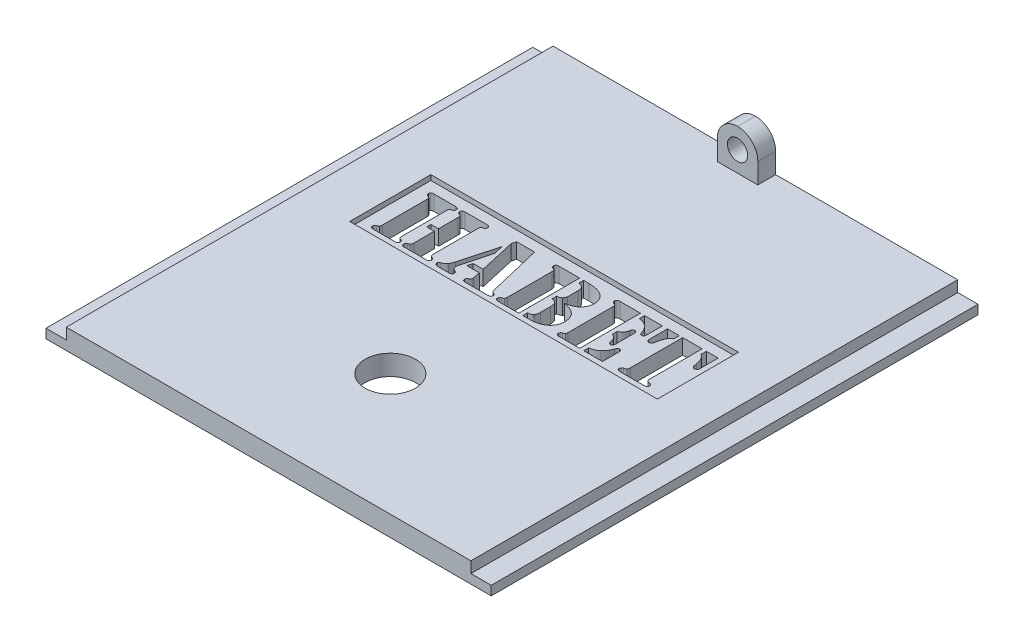
from build123d import *

# Parameters (mm, degrees)
SKETCH1_W           = 139.40028
SKETCH1_H           = 152.4
BOSS_EXTRUDE1_DEPTH = 6.35
SKETCH2_W           = 6.35
SKETCH2_H           = 152.4
CUT_EXTRUDE1_DEPTH  = 3.47472
SKETCH3_W           = 12.7
SKETCH3_H           = 5.586339271
BOSS_EXTRUDE2_DEPTH = 12.7
FILLET1_R           = 6.35
SKETCH4_R           = 3.175
CUT_EXTRUDE2_DEPTH  = 6.35
CUT_EXTRUDE7_DEPTH  = 6.35
SKETCH9_W           = 96.308333333
SKETCH9_H           = 25.4
CUT_EXTRUDE8_DEPTH  = 1.5875
SKETCH10_R          = 7.874
CUT_EXTRUDE9_DEPTH  = 207.928702993


with BuildPart() as part:
    # Sketch1 → Boss-Extrude1 (new body)
    with BuildSketch(Plane(origin=(0, 0, 0), x_dir=(1, 0, 0), z_dir=(0, 1, 0))):
        with Locations((69.70014, 76.2)):
            Rectangle(SKETCH1_W, SKETCH1_H)
    extrude(amount=BOSS_EXTRUDE1_DEPTH)

    # Sketch2 → Cut-Extrude1 (cut)
    with BuildSketch(Plane(origin=(0, 6.35, 0), x_dir=(1, 0, 0), z_dir=(0, 1, 0))):
        with Locations((3.175, 76.2)):
            Rectangle(SKETCH2_W, SKETCH2_H)
        with Locations((136.22528, 76.2)):
            Rectangle(SKETCH2_W, SKETCH2_H)
    extrude(amount=-CUT_EXTRUDE1_DEPTH, mode=Mode.SUBTRACT)

    # Sketch3 → Boss-Extrude2 (add)
    with BuildSketch(Plane(origin=(0, 6.35, 0), x_dir=(1, 0, 0), z_dir=(0, 1, 0))):
        with Locations((69.70014, 149.606830365)):
            Rectangle(SKETCH3_W, SKETCH3_H)
    extrude(amount=BOSS_EXTRUDE2_DEPTH)

    # Fillet1
    fillet1_edges = [part.edges().sort_by_distance(p)[0] for p in [
        (63.35014, 19.05, -149.606830364),
        (76.05014, 19.05, -149.606830364),
    ]]
    fillet(fillet1_edges, radius=FILLET1_R - 0.0001)  # a hair under: the kernel refuses the full size

    # Sketch4 → Cut-Extrude2 (cut)
    with BuildSketch(Plane(origin=(0, 0, -152.4), x_dir=(-1, 0, 0), z_dir=(0, 0, -1))):
        with Locations((-69.70014, 12.7)):
            Circle(SKETCH4_R)
    extrude(amount=-CUT_EXTRUDE2_DEPTH, mode=Mode.SUBTRACT)

    # Sketch7 → Cut-Extrude7 (cut)
    with BuildSketch(Plane(origin=(0, 6.35, 0), x_dir=(1, 0, 0), z_dir=(0, 1, 0))):
        with BuildLine():
            Line((33.98139, 86.51875), (36.36264, 86.51875))
            Line((36.36264, 86.51875), (36.36264, 92.674446615))
            add(Edge.make_bspline(
                [(36.36264, 92.674446615), (36.358254969, 92.79337412), (36.350353986, 93.007658614), (36.288467493, 93.292216987), (36.162305987, 93.506420615), (36.034402539, 93.575942696), (35.974033229, 93.60875651)],
                knots=[0, 0, 0, 0, 1.329658115, 2.395788229, 3.242826058, 4, 4, 4, 4], degree=3))
            Line((35.974033229, 93.60875651), (35.548219427, 93.749316406))
            add(Edge.make_bspline(
                [(35.548219427, 93.749316406), (35.470363369, 93.781123373), (35.321358774, 93.841997045), (35.155464255, 94.021364361), (35.054604435, 94.251060369), (35.044935177, 94.421992946), (35.039723333, 94.514127604)],
                knots=[0, 0, 0, 0, 1.010910902, 1.93472894, 2.886794743, 4, 4, 4, 4], degree=3))
            add(Edge.make_bspline(
                [(35.039723333, 94.514127604), (35.04336266, 94.57213883), (35.050224938, 94.681524219), (35.088866411, 94.836962832), (35.169501188, 94.963061381), (35.267416045, 95.076717923), (35.407472018, 95.152993869), (35.568945655, 95.211291763), (35.760655444, 95.243111258), (35.89676234, 95.247592183), (35.969899115, 95.25)],
                knots=[0, 0, 0, 0, 1.031021055, 1.944083, 2.799047815, 3.663736344, 4.573193868, 5.585804961, 6.702737011, 8, 8, 8, 8], degree=3))
            Line((35.969899115, 95.25), (36.346103542, 95.25))
            Line((36.346103542, 95.25), (42.448056667, 95.25))
            Line((42.448056667, 95.25), (42.824261094, 95.25))
            add(Edge.make_bspline(
                [(42.824261094, 95.25), (42.898791771, 95.247612679), (43.037665311, 95.243164367), (43.233215097, 95.21099988), (43.398335765, 95.154213485), (43.539059768, 95.075320206), (43.64142448, 94.964578719), (43.721620777, 94.836761147), (43.760533683, 94.681583868), (43.767355477, 94.572159502), (43.770973333, 94.514127604)],
                knots=[0, 0, 0, 0, 1.307240179, 2.435789904, 3.46013341, 4.359666904, 5.231495482, 6.077130894, 6.980229479, 8, 8, 8, 8], degree=3))
            add(Edge.make_bspline(
                [(43.770973333, 94.514127604), (43.765427394, 94.424815204), (43.754992327, 94.256767783), (43.654376024, 94.027773862), (43.485227457, 93.846294181), (43.333409962, 93.782563674), (43.25420901, 93.749316406)],
                knots=[0, 0, 0, 0, 1.076488905, 2.025487884, 2.96992611, 4, 4, 4, 4], degree=3))
            add(Edge.make_bspline(
                [(43.25420901, 93.749316406), (43.189425968, 93.725968045), (43.076248368, 93.685177873), (42.927147542, 93.630428772), (42.82429549, 93.589829846), (42.739491177, 93.55875196), (42.66735573, 93.495159348), (42.628064728, 93.433734975), (42.605153021, 93.397916667)],
                knots=[0, 0, 0, 0, 1.636602956, 2.859186374, 3.771360974, 4.270120389, 4.991257728, 6, 6, 6, 6], degree=3))
            add(Edge.make_bspline(
                [(42.605153021, 93.397916667), (42.579472533, 93.354754533), (42.525073829, 93.263324641), (42.485762356, 93.093362429), (42.448793771, 92.896571318), (42.44831364, 92.751884818), (42.448056667, 92.674446615)],
                knots=[0, 0, 0, 0, 0.798774196, 1.692034923, 2.764745377, 4, 4, 4, 4], degree=3))
            Line((42.448056667, 92.674446615), (42.448056667, 78.783821615))
            add(Edge.make_bspline(
                [(42.448056667, 78.783821615), (42.451553734, 78.668832217), (42.457937005, 78.458939622), (42.532250986, 78.178888253), (42.666620642, 77.962588408), (42.800976502, 77.889028473), (42.86560224, 77.853645833)],
                knots=[0, 0, 0, 0, 1.273136709, 2.323883542, 3.193780884, 4, 4, 4, 4], degree=3))
            Line((42.86560224, 77.853645833), (43.266611354, 77.700683594))
            add(Edge.make_bspline(
                [(43.266611354, 77.700683594), (43.342375807, 77.666632393), (43.488753114, 77.600845301), (43.66197076, 77.426532205), (43.752659696, 77.192828477), (43.764635802, 77.024793412), (43.770973333, 76.935872396)],
                knots=[0, 0, 0, 0, 1.008735212, 1.948881546, 2.914586453, 4, 4, 4, 4], degree=3))
            add(Edge.make_bspline(
                [(43.770973333, 76.935872396), (43.767383149, 76.877810317), (43.760613534, 76.768329042), (43.721350783, 76.613533324), (43.642901287, 76.485228447), (43.536300035, 76.379579608), (43.399994513, 76.294578242), (43.232911828, 76.239447166), (43.037758826, 76.206697784), (42.898824431, 76.202339178), (42.824261094, 76.2)],
                knots=[0, 0, 0, 0, 1.020367685, 1.923995112, 2.770125717, 3.62519578, 4.537840383, 5.562783731, 6.691994319, 8, 8, 8, 8], degree=3))
            Line((42.824261094, 76.2), (42.448056667, 76.2))
            Line((42.448056667, 76.2), (36.346103542, 76.2))
            Line((36.346103542, 76.2), (35.940960313, 76.2))
            add(Edge.make_bspline(
                [(35.940960313, 76.2), (35.870520425, 76.202386592), (35.738419135, 76.206862349), (35.552881903, 76.23946176), (35.39342755, 76.294319164), (35.265559402, 76.381088307), (35.162631216, 76.485218543), (35.091463164, 76.615493806), (35.043260004, 76.767155513), (35.040945409, 76.877573254), (35.039723333, 76.935872396)],
                knots=[0, 0, 0, 0, 1.272236934, 2.38592289, 3.394408416, 4.29229074, 5.155307538, 6.014002022, 6.951418688, 8, 8, 8, 8], degree=3))
            add(Edge.make_bspline(
                [(35.039723333, 76.935872396), (35.045537841, 77.025063688), (35.056560809, 77.194149861), (35.154074399, 77.423933889), (35.322342623, 77.603448603), (35.470519219, 77.667235365), (35.548219427, 77.700683594)],
                knots=[0, 0, 0, 0, 1.082756457, 2.052657179, 2.978860728, 4, 4, 4, 4], degree=3))
            Line((35.548219427, 77.700683594), (35.974033229, 77.853645833))
            add(Edge.make_bspline(
                [(35.974033229, 77.853645833), (36.034583478, 77.883362518), (36.164380885, 77.947064133), (36.287999465, 78.162629813), (36.350817717, 78.447572739), (36.358406621, 78.663416038), (36.36264, 78.783821615)],
                knots=[0, 0, 0, 0, 0.740865868, 1.588143233, 2.65457484, 4, 4, 4, 4], degree=3))
            Line((36.36264, 78.783821615), (36.36264, 85.195833333))
            Line((36.36264, 85.195833333), (33.98139, 85.195833333))
            Line((33.98139, 85.195833333), (33.98139, 86.51875))
        make_face()
        with BuildLine():
            Line((32.670875677, 76.2), (26.560654323, 76.2))
            Line((26.560654323, 76.2), (26.19685224, 76.2))
            add(Edge.make_bspline(
                [(26.19685224, 76.2), (26.125040689, 76.202376158), (25.99021491, 76.20683738), (25.799288606, 76.239878552), (25.632545952, 76.295443288), (25.493913669, 76.379738123), (25.3803164, 76.484168123), (25.308200717, 76.615713486), (25.258386897, 76.762863504), (25.25299464, 76.867876553), (25.25014, 76.923470052)],
                knots=[0, 0, 0, 0, 1.275809178, 2.395324508, 3.433364274, 4.378530456, 5.262016052, 6.140052186, 7.015350866, 8, 8, 8, 8], degree=3))
            add(Edge.make_bspline(
                [(25.25014, 76.923470052), (25.255764401, 77.011322637), (25.266343696, 77.176570169), (25.365586585, 77.402040721), (25.53902331, 77.574260052), (25.688152596, 77.638055756), (25.766904323, 77.671744792)],
                knots=[0, 0, 0, 0, 1.074896783, 2.021841926, 2.955380476, 4, 4, 4, 4], degree=3))
            add(Edge.make_bspline(
                [(25.766904323, 77.671744792), (25.831764671, 77.694901049), (25.945077324, 77.73535561), (26.091766098, 77.791349819), (26.194674971, 77.827086055), (26.278053349, 77.859200862), (26.353929924, 77.919864491), (26.393323411, 77.982828852), (26.415960313, 78.019010417)],
                knots=[0, 0, 0, 0, 1.641128884, 2.867093284, 3.73955991, 4.239698614, 4.988468111, 6, 6, 6, 6], degree=3))
            add(Edge.make_bspline(
                [(26.415960313, 78.019010417), (26.441295424, 78.060864408), (26.495870371, 78.151023056), (26.540989365, 78.315666281), (26.570686683, 78.509819854), (26.572223759, 78.649989265), (26.573056667, 78.72594401)],
                knots=[0, 0, 0, 0, 0.795728394, 1.714096871, 2.761318972, 4, 4, 4, 4], degree=3))
            Line((26.573056667, 78.72594401), (26.573056667, 92.674446615))
            add(Edge.make_bspline(
                [(26.573056667, 92.674446615), (26.572046863, 92.751741764), (26.570162914, 92.895948045), (26.542191832, 93.09462471), (26.494872664, 93.262615041), (26.441203426, 93.354635303), (26.415960313, 93.397916667)],
                knots=[0, 0, 0, 0, 1.234380862, 2.302932019, 3.201790819, 4, 4, 4, 4], degree=3))
            add(Edge.make_bspline(
                [(26.415960313, 93.397916667), (26.393311355, 93.434066441), (26.353896887, 93.496975479), (26.278134024, 93.55793895), (26.193961827, 93.589345755), (26.092981985, 93.631533479), (25.944777423, 93.684916037), (25.831655498, 93.725872729), (25.766904323, 93.749316406)],
                knots=[0, 0, 0, 0, 1.009569614, 1.75688657, 2.256055053, 3.138468602, 4.362054748, 6, 6, 6, 6], degree=3))
            add(Edge.make_bspline(
                [(25.766904323, 93.749316406), (25.687703372, 93.782563674), (25.535885877, 93.846294181), (25.366737309, 94.027773862), (25.266121006, 94.256767783), (25.255685939, 94.424815204), (25.25014, 94.514127604)],
                knots=[0, 0, 0, 0, 1.03007389, 1.974512116, 2.923511095, 4, 4, 4, 4], degree=3))
            add(Edge.make_bspline(
                [(25.25014, 94.514127604), (25.253061441, 94.571058029), (25.258584712, 94.678690563), (25.307217029, 94.829116359), (25.380433718, 94.961594207), (25.493782166, 95.066425937), (25.633401371, 95.149446212), (25.798303404, 95.211468089), (25.990370768, 95.242735765), (26.125094854, 95.2474755), (26.19685224, 95.25)],
                knots=[0, 0, 0, 0, 1.002003185, 1.894384998, 2.766311233, 3.643649008, 4.582238159, 5.621343591, 6.733068665, 8, 8, 8, 8], degree=3))
            Line((26.19685224, 95.25), (26.560654323, 95.25))
            Line((26.560654323, 95.25), (32.670875677, 95.25))
            Line((32.670875677, 95.25), (33.03467776, 95.25))
            add(Edge.make_bspline(
                [(33.03467776, 95.25), (33.109208438, 95.247612679), (33.248081978, 95.243164367), (33.443631763, 95.21099988), (33.608752432, 95.154213485), (33.749476435, 95.075320206), (33.851841147, 94.964578719), (33.932037444, 94.836761147), (33.970950349, 94.681583868), (33.977772143, 94.572159502), (33.98139, 94.514127604)],
                knots=[0, 0, 0, 0, 1.307240179, 2.435789904, 3.46013341, 4.359666904, 5.231495482, 6.077130894, 6.980229479, 8, 8, 8, 8], degree=3))
            add(Edge.make_bspline(
                [(33.98139, 94.514127604), (33.976105432, 94.42206441), (33.966301251, 94.251264417), (33.865944671, 94.019796617), (33.695643123, 93.843228467), (33.546317909, 93.781419437), (33.468759792, 93.749316406)],
                knots=[0, 0, 0, 0, 1.109983163, 2.059293279, 2.992015108, 4, 4, 4, 4], degree=3))
            Line((33.468759792, 93.749316406), (33.051214219, 93.60875651))
            add(Edge.make_bspline(
                [(33.051214219, 93.60875651), (32.98888829, 93.5764385), (32.858683699, 93.508923206), (32.738857753, 93.289917427), (32.668583654, 93.008801655), (32.662078061, 92.793657362), (32.658473333, 92.674446615)],
                knots=[0, 0, 0, 0, 0.768469074, 1.605402508, 2.673161374, 4, 4, 4, 4], degree=3))
            Line((32.658473333, 92.674446615), (32.658473333, 78.72594401))
            add(Edge.make_bspline(
                [(32.658473333, 78.72594401), (32.661883817, 78.609413714), (32.668025728, 78.399555311), (32.740580589, 78.124696759), (32.858603203, 77.907979191), (32.988862232, 77.840480592), (33.051214219, 77.808170573)],
                knots=[0, 0, 0, 0, 1.316005662, 2.369983217, 3.219748642, 4, 4, 4, 4], degree=3))
            Line((33.051214219, 77.808170573), (33.468759792, 77.671744792))
            add(Edge.make_bspline(
                [(33.468759792, 77.671744792), (33.546199843, 77.641049819), (33.694905023, 77.582107431), (33.867066383, 77.409191576), (33.964979806, 77.180475024), (33.975695118, 77.012659308), (33.98139, 76.923470052)],
                knots=[0, 0, 0, 0, 1.013906066, 1.946965185, 2.908870689, 4, 4, 4, 4], degree=3))
            add(Edge.make_bspline(
                [(33.98139, 76.923470052), (33.977716568, 76.866780426), (33.970711377, 76.758673959), (33.931592537, 76.60541922), (33.854459795, 76.477255135), (33.746284361, 76.375168893), (33.609219932, 76.29532482), (33.443486072, 76.239144002), (33.248126903, 76.206791266), (33.109224128, 76.202371826), (33.03467776, 76.2)],
                knots=[0, 0, 0, 0, 1.003012501, 1.91273332, 2.764569601, 3.608364563, 4.51449415, 5.546348955, 6.6831741, 8, 8, 8, 8], degree=3))
            Line((33.03467776, 76.2), (32.670875677, 76.2))
        make_face()
        with BuildLine():
            Line((52.097080104, 95.25), (57.719475938, 95.25))
            Line((57.719475938, 95.25), (61.626214219, 78.849967448))
            add(Edge.make_bspline(
                [(61.626214219, 78.849967448), (61.663908229, 78.714167542), (61.735791565, 78.45519403), (61.832431222, 78.204426775), (61.878395208, 78.08515625)],
                knots=[0, 0, 0, 0, 1.048755183, 2, 2, 2, 2], degree=3))
            add(Edge.make_bspline(
                [(61.878395208, 78.08515625), (61.903775603, 78.040721307), (61.956415575, 77.948561425), (62.086098711, 77.836151776), (62.247337704, 77.73267795), (62.373455726, 77.679435031), (62.440634792, 77.651074219)],
                knots=[0, 0, 0, 0, 0.840160251, 1.742526606, 2.797515595, 4, 4, 4, 4], degree=3))
            add(Edge.make_bspline(
                [(62.440634792, 77.651074219), (62.546019514, 77.60421987), (62.72678057, 77.523852987), (62.947620792, 77.365376206), (63.073527844, 77.159540795), (63.081391452, 77.007916743), (63.085556667, 76.927604167)],
                knots=[0, 0, 0, 0, 1.326867952, 2.275909135, 3.086779591, 4, 4, 4, 4], degree=3))
            add(Edge.make_bspline(
                [(63.085556667, 76.927604167), (63.083044393, 76.870610428), (63.078197883, 76.760661926), (63.022192103, 76.608108908), (62.931589388, 76.477852908), (62.803885359, 76.373596881), (62.640694722, 76.295202274), (62.445308952, 76.238324756), (62.214241495, 76.207023002), (62.049365909, 76.202449202), (61.9610775, 76.2)],
                knots=[0, 0, 0, 0, 0.899652897, 1.735550104, 2.535289427, 3.388132219, 4.315971308, 5.386976564, 6.600765056, 8, 8, 8, 8], degree=3))
            Line((61.9610775, 76.2), (54.999228542, 76.2))
            add(Edge.make_bspline(
                [(54.999228542, 76.2), (54.934178971, 76.201768506), (54.808151906, 76.205194811), (54.63154095, 76.248414359), (54.471893417, 76.310201857), (54.336293061, 76.400351231), (54.227086661, 76.513792589), (54.145592604, 76.644076493), (54.099425362, 76.793726157), (54.093028058, 76.898358033), (54.089723333, 76.952408854)],
                knots=[0, 0, 0, 0, 1.175318829, 2.277063206, 3.273429624, 4.263211015, 5.198644873, 6.106027898, 7.021610334, 8, 8, 8, 8], degree=3))
            add(Edge.make_bspline(
                [(54.089723333, 76.952408854), (54.092333304, 77.03589774), (54.096978067, 77.184476414), (54.169258916, 77.358870658), (54.267663195, 77.465599972), (54.375519239, 77.546627241), (54.509765512, 77.642792935), (54.615420346, 77.701802334), (54.67263349, 77.73375651)],
                knots=[0, 0, 0, 0, 1.432553572, 2.549404146, 3.155101411, 3.915709373, 4.871335893, 6, 6, 6, 6], degree=3))
            add(Edge.make_bspline(
                [(54.67263349, 77.73375651), (54.749784625, 77.781089926), (54.888697166, 77.866314921), (55.048779309, 78.038471568), (55.139320671, 78.245156556), (55.145018229, 78.394252163), (55.148056667, 78.473763021)],
                knots=[0, 0, 0, 0, 1.161992046, 2.092195629, 2.982591342, 4, 4, 4, 4], degree=3))
            add(Edge.make_bspline(
                [(55.148056667, 78.473763021), (55.147476783, 78.549752782), (55.146385804, 78.692718112), (55.122186422, 78.833584537), (55.110849635, 78.899576823)],
                knots=[0, 0, 0, 0, 1.063051602, 2, 2, 2, 2], degree=3))
            Line((55.110849635, 78.899576823), (54.705706406, 80.9625))
            Line((54.705706406, 80.9625), (50.815504583, 80.9625))
            Line((50.815504583, 80.9625), (51.19170901, 82.55))
            Line((51.19170901, 82.55), (54.317099635, 82.55))
            Line((54.317099635, 82.55), (51.749814479, 93.8609375))
            Line((51.749814479, 93.8609375), (52.097080104, 95.25))
        make_face()
        with BuildLine():
            Line((51.133831406, 91.653320312), (51.844899115, 88.751171875))
            Line((51.844899115, 88.751171875), (49.434710313, 79.780143229))
            add(Edge.make_bspline(
                [(49.434710313, 79.780143229), (49.404442749, 79.656718777), (49.346438878, 79.420191774), (49.333439419, 79.177065489), (49.327223333, 79.060807292)],
                knots=[0, 0, 0, 0, 1.043639418, 2, 2, 2, 2], degree=3))
            add(Edge.make_bspline(
                [(49.327223333, 79.060807292), (49.334278502, 78.924141807), (49.347750577, 78.663174622), (49.497289144, 78.306918913), (49.732700161, 78.007051937), (49.950233498, 77.87882982), (50.063095729, 77.812304687)],
                knots=[0, 0, 0, 0, 1.065909191, 2.035388236, 2.980705811, 4, 4, 4, 4], degree=3))
            Line((50.063095729, 77.812304687), (50.501311875, 77.5890625))
            add(Edge.make_bspline(
                [(50.501311875, 77.5890625), (50.564634562, 77.551119218), (50.685353588, 77.478783754), (50.822393704, 77.314781266), (50.902845564, 77.114995286), (50.910673713, 76.969696514), (50.914723333, 76.89453125)],
                knots=[0, 0, 0, 0, 1.03129857, 1.96607825, 2.947821365, 4, 4, 4, 4], degree=3))
            add(Edge.make_bspline(
                [(50.914723333, 76.89453125), (50.913414574, 76.840364794), (50.910910151, 76.736712589), (50.862304065, 76.593243141), (50.791211119, 76.470365505), (50.693387766, 76.3651821), (50.560513591, 76.293418377), (50.404283934, 76.239008435), (50.22006117, 76.20690764), (50.088025413, 76.202402343), (50.017620469, 76.2)],
                knots=[0, 0, 0, 0, 1.001089615, 1.915671698, 2.776004461, 3.626767041, 4.544209435, 5.547912865, 6.692482548, 8, 8, 8, 8], degree=3))
            Line((50.017620469, 76.2), (46.474684271, 76.2))
            add(Edge.make_bspline(
                [(46.474684271, 76.2), (46.393165819, 76.201748698), (46.237223015, 76.205093915), (46.017440351, 76.247354884), (45.82223882, 76.312594435), (45.657289001, 76.406213205), (45.52349119, 76.525301254), (45.42643889, 76.666646734), (45.371082155, 76.831477198), (45.362779988, 76.9464905), (45.358473333, 77.006152344)],
                knots=[0, 0, 0, 0, 1.263225168, 2.41651886, 3.457937625, 4.444571192, 5.337806274, 6.215550556, 7.074337118, 8, 8, 8, 8], degree=3))
            add(Edge.make_bspline(
                [(45.358473333, 77.006152344), (45.365632938, 77.072691554), (45.380469635, 77.210579343), (45.51241368, 77.394878213), (45.711854483, 77.554665749), (45.878451373, 77.632794376), (45.970322292, 77.675878906)],
                knots=[0, 0, 0, 0, 0.824400861, 1.708388363, 2.736276122, 4, 4, 4, 4], degree=3))
            add(Edge.make_bspline(
                [(45.970322292, 77.675878906), (46.060215941, 77.715116947), (46.229184636, 77.788870772), (46.460757524, 77.902778389), (46.651523513, 78.015274139), (46.864259539, 78.156330633), (47.100586801, 78.369083883), (47.25646636, 78.570211968), (47.338714219, 78.676334635)],
                knots=[0, 0, 0, 0, 1.026075952, 1.928664772, 2.697596979, 3.341335493, 4.597189607, 6, 6, 6, 6], degree=3))
            add(Edge.make_bspline(
                [(47.338714219, 78.676334635), (47.402883936, 78.778493946), (47.536952591, 78.991933588), (47.702873981, 79.351142535), (47.858697725, 79.753364872), (47.938043795, 80.042488231), (47.979501979, 80.193554687)],
                knots=[0, 0, 0, 0, 0.874304226, 1.826668352, 2.864437965, 4, 4, 4, 4], degree=3))
            Line((47.979501979, 80.193554687), (51.133831406, 91.653320312))
        make_face()
        with BuildLine():
            Line((71.816806667, 95.25), (71.816806667, 76.2))
            Line((71.816806667, 76.2), (65.718987656, 76.2))
            Line((65.718987656, 76.2), (65.355185573, 76.2))
            add(Edge.make_bspline(
                [(65.355185573, 76.2), (65.283374023, 76.202376158), (65.148548243, 76.20683738), (64.95762194, 76.239878552), (64.790879285, 76.295443288), (64.652247002, 76.379738123), (64.538649733, 76.484168123), (64.466534051, 76.615713486), (64.41672023, 76.762863504), (64.411327973, 76.867876553), (64.408473333, 76.923470052)],
                knots=[0, 0, 0, 0, 1.275809178, 2.395324508, 3.433364274, 4.378530456, 5.262016052, 6.140052186, 7.015350866, 8, 8, 8, 8], degree=3))
            add(Edge.make_bspline(
                [(64.408473333, 76.923470052), (64.414097735, 77.011322637), (64.42467703, 77.176570169), (64.523919918, 77.402040721), (64.697356644, 77.574260052), (64.84648593, 77.638055756), (64.925237656, 77.671744792)],
                knots=[0, 0, 0, 0, 1.074896783, 2.021841926, 2.955380476, 4, 4, 4, 4], degree=3))
            add(Edge.make_bspline(
                [(64.925237656, 77.671744792), (64.990098004, 77.694901049), (65.103410658, 77.73535561), (65.250099431, 77.791349819), (65.353008305, 77.827086055), (65.436386683, 77.859200862), (65.512263257, 77.919864491), (65.551656744, 77.982828852), (65.574293646, 78.019010417)],
                knots=[0, 0, 0, 0, 1.641128884, 2.867093284, 3.73955991, 4.239698614, 4.988468111, 6, 6, 6, 6], degree=3))
            add(Edge.make_bspline(
                [(65.574293646, 78.019010417), (65.599628757, 78.060864408), (65.654203704, 78.151023056), (65.699322698, 78.315666281), (65.729020017, 78.509819854), (65.730557092, 78.649989265), (65.73139, 78.72594401)],
                knots=[0, 0, 0, 0, 0.795728394, 1.714096871, 2.761318972, 4, 4, 4, 4], degree=3))
            Line((65.73139, 78.72594401), (65.73139, 92.674446615))
            add(Edge.make_bspline(
                [(65.73139, 92.674446615), (65.730380196, 92.751741764), (65.728496247, 92.895948045), (65.700525166, 93.09462471), (65.653205998, 93.262615041), (65.599536759, 93.354635303), (65.574293646, 93.397916667)],
                knots=[0, 0, 0, 0, 1.234380862, 2.302932019, 3.201790819, 4, 4, 4, 4], degree=3))
            add(Edge.make_bspline(
                [(65.574293646, 93.397916667), (65.551644688, 93.434066441), (65.512230221, 93.496975479), (65.436467358, 93.55793895), (65.35229516, 93.589345755), (65.251315318, 93.631533479), (65.103110757, 93.684916037), (64.989988831, 93.725872729), (64.925237656, 93.749316406)],
                knots=[0, 0, 0, 0, 1.009569614, 1.75688657, 2.256055053, 3.138468602, 4.362054748, 6, 6, 6, 6], degree=3))
            add(Edge.make_bspline(
                [(64.925237656, 93.749316406), (64.846036705, 93.782563674), (64.69421921, 93.846294181), (64.525070643, 94.027773862), (64.424454339, 94.256767783), (64.414019273, 94.424815204), (64.408473333, 94.514127604)],
                knots=[0, 0, 0, 0, 1.03007389, 1.974512116, 2.923511095, 4, 4, 4, 4], degree=3))
            add(Edge.make_bspline(
                [(64.408473333, 94.514127604), (64.411394775, 94.571058029), (64.416918045, 94.678690563), (64.465550362, 94.829116359), (64.538767051, 94.961594207), (64.652115499, 95.066425937), (64.791734704, 95.149446212), (64.956636737, 95.211468089), (65.148704101, 95.242735765), (65.283428187, 95.2474755), (65.355185573, 95.25)],
                knots=[0, 0, 0, 0, 1.002003185, 1.894384998, 2.766311233, 3.643649008, 4.582238159, 5.621343591, 6.733068665, 8, 8, 8, 8], degree=3))
            Line((65.355185573, 95.25), (65.718987656, 95.25))
            Line((65.718987656, 95.25), (71.816806667, 95.25))
        make_face()
        with BuildLine():
            add(Edge.make_bspline(
                [(76.281650417, 86.014388021), (76.478840916, 85.973691726), (76.849208839, 85.897254968), (77.368896462, 85.779986424), (77.813759769, 85.655927045), (78.304961766, 85.498926129), (78.849044115, 85.284018209), (79.234934634, 85.047078267), (79.4235775, 84.93125)],
                knots=[0, 0, 0, 0, 1.083455462, 2.034972021, 2.866135129, 3.567292239, 4.810769005, 6, 6, 6, 6], degree=3))
            add(Edge.make_bspline(
                [(79.4235775, 84.93125), (79.572639243, 84.827566522), (79.867499636, 84.622469287), (80.255212908, 84.249710742), (80.585392286, 83.827269243), (80.855667388, 83.357932162), (81.078101722, 82.854721736), (81.226915086, 82.316775349), (81.328808281, 81.753222551), (81.337410142, 81.366741365), (81.341806667, 81.169205729)],
                knots=[0, 0, 0, 0, 0.986962337, 1.952319205, 2.913940247, 3.895330921, 4.892864158, 5.89929397, 6.926301415, 8, 8, 8, 8], degree=3))
            add(Edge.make_bspline(
                [(81.341806667, 81.169205729), (81.335874739, 80.976013916), (81.324341144, 80.600386192), (81.245419652, 80.052355628), (81.110317481, 79.536610943), (80.91286287, 79.055553817), (80.669584652, 78.602629484), (80.362028387, 78.188372275), (80.008538741, 77.799140165), (79.732698478, 77.577318637), (79.593076198, 77.465039062)],
                knots=[0, 0, 0, 0, 1.089371359, 2.118092263, 3.115302193, 4.087984299, 5.044386056, 6.006580044, 6.990989071, 8, 8, 8, 8], degree=3))
            add(Edge.make_bspline(
                [(79.593076198, 77.465039062), (79.441047279, 77.354003712), (79.138956806, 77.133369887), (78.645663877, 76.865959611), (78.132108768, 76.646282421), (77.585889358, 76.471531415), (76.985383601, 76.350047773), (76.31295452, 76.259821661), (75.556250222, 76.207495878), (75.023584027, 76.202581604), (74.743759792, 76.2)],
                knots=[0, 0, 0, 0, 0.883012022, 1.754597232, 2.627046443, 3.502775865, 4.441750639, 5.499460937, 6.686397901, 8, 8, 8, 8], degree=3))
            Line((74.743759792, 76.2), (73.081845729, 76.2))
            Line((73.081845729, 76.2), (73.081845729, 77.667610677))
            add(Edge.make_bspline(
                [(73.081845729, 77.667610677), (73.170215368, 77.674481121), (73.337916393, 77.687519315), (73.571699745, 77.727195563), (73.777443806, 77.765382097), (74.011722197, 77.837195971), (74.279274479, 77.974402899), (74.447234826, 78.140818883), (74.532919948, 78.225716146)],
                knots=[0, 0, 0, 0, 0.997306068, 1.892609856, 2.668508782, 3.350634199, 4.648423657, 6, 6, 6, 6], degree=3))
            add(Edge.make_bspline(
                [(74.532919948, 78.225716146), (74.605854051, 78.320517532), (74.759336565, 78.520017552), (74.889075163, 78.901386305), (74.979411386, 79.341630385), (74.987486486, 79.659625259), (74.991806667, 79.829752604)],
                knots=[0, 0, 0, 0, 0.837912566, 1.76330307, 2.803366532, 4, 4, 4, 4], degree=3))
            Line((74.991806667, 79.829752604), (74.991806667, 82.963411458))
            add(Edge.make_bspline(
                [(74.991806667, 82.963411458), (74.989920245, 83.072301518), (74.986334776, 83.279265741), (74.968068927, 83.56944867), (74.931294449, 83.822832007), (74.861155711, 84.107472648), (74.722093396, 84.438105106), (74.534248838, 84.646514429), (74.437835313, 84.753483073)],
                knots=[0, 0, 0, 0, 1.01571249, 1.930535679, 2.71034331, 3.399269007, 4.665142888, 6, 6, 6, 6], degree=3))
            add(Edge.make_bspline(
                [(74.437835313, 84.753483073), (74.359907295, 84.829609551), (74.208827981, 84.977196214), (73.915700236, 85.127830957), (73.55914543, 85.234768064), (73.292193952, 85.273137306), (73.139723333, 85.295052083)],
                knots=[0, 0, 0, 0, 0.904188909, 1.752954129, 2.716588957, 4, 4, 4, 4], degree=3))
            Line((73.139723333, 85.295052083), (73.139723333, 86.737858073))
            add(Edge.make_bspline(
                [(73.139723333, 86.737858073), (73.291706292, 86.752308872), (73.559500905, 86.77777124), (73.922828212, 86.857187916), (74.21628901, 86.997650878), (74.374213644, 87.129713499), (74.454371771, 87.196744792)],
                knots=[0, 0, 0, 0, 1.287514427, 2.268605844, 3.12119275, 4, 4, 4, 4], degree=3))
            add(Edge.make_bspline(
                [(74.454371771, 87.196744792), (74.52526596, 87.274237889), (74.673522786, 87.436294618), (74.832087179, 87.731936014), (74.956331797, 88.036774983), (74.980631355, 88.248607402), (74.991806667, 88.346028646)],
                knots=[0, 0, 0, 0, 0.970759611, 2.030092153, 3.0940439, 4, 4, 4, 4], degree=3))
            Line((74.991806667, 88.346028646), (74.991806667, 89.110839844))
            Line((74.991806667, 89.110839844), (74.991806667, 91.595442708))
            add(Edge.make_bspline(
                [(74.991806667, 91.595442708), (74.985026886, 91.724273986), (74.971006393, 91.99069529), (74.868524816, 92.37648405), (74.7519606, 92.740008769), (74.61828646, 92.942413827), (74.557724635, 93.034114583)],
                knots=[0, 0, 0, 0, 1.013786551, 2.096496594, 3.137607017, 4, 4, 4, 4], degree=3))
            add(Edge.make_bspline(
                [(74.557724635, 93.034114583), (74.468083274, 93.130992506), (74.295328802, 93.31769309), (74.022476146, 93.487889106), (73.782512852, 93.581789381), (73.573974052, 93.637155092), (73.338696589, 93.689316001), (73.170319818, 93.706968127), (73.081845729, 93.71624349)],
                knots=[0, 0, 0, 0, 1.414668104, 2.726311148, 3.411527514, 4.180983567, 5.044192262, 6, 6, 6, 6], degree=3))
            Line((73.081845729, 93.71624349), (73.081845729, 95.25))
            Line((73.081845729, 95.25), (74.685882188, 95.25))
            add(Edge.make_bspline(
                [(74.685882188, 95.25), (74.942332652, 95.246314056), (75.439491228, 95.239168432), (76.161710672, 95.176113185), (76.83613003, 95.074792576), (77.464078067, 94.930789095), (78.044483574, 94.744140427), (78.582028472, 94.522092075), (79.073710797, 94.255746964), (79.366629533, 94.038058728), (79.510393906, 93.931217448)],
                knots=[0, 0, 0, 0, 1.208139577, 2.342116839, 3.412856412, 4.419296771, 5.374125253, 6.282151548, 7.156880815, 8, 8, 8, 8], degree=3))
            add(Edge.make_bspline(
                [(79.510393906, 93.931217448), (79.63310187, 93.828067387), (79.874746233, 93.624937695), (80.186427223, 93.270424721), (80.45802493, 92.889424605), (80.680115548, 92.474429803), (80.857130541, 92.037771895), (80.98864178, 91.58113807), (81.062715908, 91.105934653), (81.0723635, 90.782644397), (81.077223333, 90.619791667)],
                knots=[0, 0, 0, 0, 1.013187354, 1.995233284, 2.977588935, 3.968692565, 4.966259194, 5.954519567, 6.969619199, 8, 8, 8, 8], degree=3))
            add(Edge.make_bspline(
                [(81.077223333, 90.619791667), (81.072922625, 90.458214379), (81.064379258, 90.137240657), (80.981375582, 89.663457727), (80.854381557, 89.202917774), (80.675687799, 88.76122426), (80.455824124, 88.344441626), (80.186367119, 87.965126187), (79.881692112, 87.617318704), (79.645448389, 87.41983916), (79.526930365, 87.320768229)],
                knots=[0, 0, 0, 0, 1.027420393, 2.040973403, 3.051676841, 4.062988861, 5.067394782, 6.043057479, 7.018247088, 8, 8, 8, 8], degree=3))
            add(Edge.make_bspline(
                [(79.526930365, 87.320768229), (79.337016939, 87.177384044), (78.949898476, 86.885110525), (78.38229446, 86.621071447), (77.868111414, 86.438067079), (77.404893557, 86.293684924), (76.868097978, 86.150437642), (76.484507531, 86.061448723), (76.281650417, 86.014388021)],
                knots=[0, 0, 0, 0, 1.210113677, 2.466688938, 3.168799978, 3.992996522, 4.938620763, 6, 6, 6, 6], degree=3))
        make_face()
        with BuildLine():
            Line((90.866806667, 95.25), (90.866806667, 76.2))
            Line((90.866806667, 76.2), (84.768987656, 76.2))
            Line((84.768987656, 76.2), (84.405185573, 76.2))
            add(Edge.make_bspline(
                [(84.405185573, 76.2), (84.333374023, 76.202376158), (84.198548243, 76.20683738), (84.00762194, 76.239878552), (83.840879285, 76.295443288), (83.702247002, 76.379738123), (83.588649733, 76.484168123), (83.516534051, 76.615713486), (83.46672023, 76.762863504), (83.461327973, 76.867876553), (83.458473333, 76.923470052)],
                knots=[0, 0, 0, 0, 1.275809178, 2.395324508, 3.433364274, 4.378530456, 5.262016052, 6.140052186, 7.015350866, 8, 8, 8, 8], degree=3))
            add(Edge.make_bspline(
                [(83.458473333, 76.923470052), (83.464097735, 77.011322637), (83.47467703, 77.176570169), (83.573919918, 77.402040721), (83.747356644, 77.574260052), (83.89648593, 77.638055756), (83.975237656, 77.671744792)],
                knots=[0, 0, 0, 0, 1.074896783, 2.021841926, 2.955380476, 4, 4, 4, 4], degree=3))
            add(Edge.make_bspline(
                [(83.975237656, 77.671744792), (84.040098004, 77.694901049), (84.153410658, 77.73535561), (84.300099431, 77.791349819), (84.403008305, 77.827086055), (84.486386683, 77.859200862), (84.562263257, 77.919864491), (84.601656744, 77.982828852), (84.624293646, 78.019010417)],
                knots=[0, 0, 0, 0, 1.641128884, 2.867093284, 3.73955991, 4.239698614, 4.988468111, 6, 6, 6, 6], degree=3))
            add(Edge.make_bspline(
                [(84.624293646, 78.019010417), (84.649628757, 78.060864408), (84.704203704, 78.151023056), (84.749322698, 78.315666281), (84.779020017, 78.509819854), (84.780557092, 78.649989265), (84.78139, 78.72594401)],
                knots=[0, 0, 0, 0, 0.795728394, 1.714096871, 2.761318972, 4, 4, 4, 4], degree=3))
            Line((84.78139, 78.72594401), (84.78139, 92.674446615))
            add(Edge.make_bspline(
                [(84.78139, 92.674446615), (84.780380196, 92.751741764), (84.778496247, 92.895948045), (84.750525166, 93.09462471), (84.703205998, 93.262615041), (84.649536759, 93.354635303), (84.624293646, 93.397916667)],
                knots=[0, 0, 0, 0, 1.234380862, 2.302932019, 3.201790819, 4, 4, 4, 4], degree=3))
            add(Edge.make_bspline(
                [(84.624293646, 93.397916667), (84.601644688, 93.434066441), (84.562230221, 93.496975479), (84.486467358, 93.55793895), (84.40229516, 93.589345755), (84.301315318, 93.631533479), (84.153110757, 93.684916037), (84.039988831, 93.725872729), (83.975237656, 93.749316406)],
                knots=[0, 0, 0, 0, 1.009569614, 1.75688657, 2.256055053, 3.138468602, 4.362054748, 6, 6, 6, 6], degree=3))
            add(Edge.make_bspline(
                [(83.975237656, 93.749316406), (83.896036705, 93.782563674), (83.74421921, 93.846294181), (83.575070643, 94.027773862), (83.474454339, 94.256767783), (83.464019273, 94.424815204), (83.458473333, 94.514127604)],
                knots=[0, 0, 0, 0, 1.03007389, 1.974512116, 2.923511095, 4, 4, 4, 4], degree=3))
            add(Edge.make_bspline(
                [(83.458473333, 94.514127604), (83.461394775, 94.571058029), (83.466918045, 94.678690563), (83.515550362, 94.829116359), (83.588767051, 94.961594207), (83.702115499, 95.066425937), (83.841734704, 95.149446212), (84.006636737, 95.211468089), (84.198704101, 95.242735765), (84.333428187, 95.2474755), (84.405185573, 95.25)],
                knots=[0, 0, 0, 0, 1.002003185, 1.894384998, 2.766311233, 3.643649008, 4.582238159, 5.621343591, 6.733068665, 8, 8, 8, 8], degree=3))
            Line((84.405185573, 95.25), (84.768987656, 95.25))
            Line((84.768987656, 95.25), (90.866806667, 95.25))
        make_face()
        with BuildLine():
            Line((92.189723333, 95.25), (97.745973333, 95.25))
            Line((97.745973333, 95.25), (97.745973333, 90.23531901))
            add(Edge.make_bspline(
                [(97.745973333, 90.23531901), (97.745701843, 90.168906164), (97.745199829, 90.046102181), (97.708664377, 89.87730554), (97.663331491, 89.732677828), (97.586737068, 89.617606835), (97.486951467, 89.529868618), (97.362955485, 89.473926561), (97.217861162, 89.434125699), (97.112407772, 89.430903301), (97.055576198, 89.429166667)],
                knots=[0, 0, 0, 0, 1.297100046, 2.398467488, 3.37194797, 4.248080405, 5.071011418, 5.940462097, 6.890061477, 8, 8, 8, 8], degree=3))
            add(Edge.make_bspline(
                [(97.055576198, 89.429166667), (96.968415897, 89.4345285), (96.813738727, 89.444043764), (96.627896524, 89.521378384), (96.541062394, 89.641895965), (96.473108477, 89.75571071), (96.409314475, 89.903432199), (96.372510317, 90.014523679), (96.352776719, 90.074088542)],
                knots=[0, 0, 0, 0, 1.496408907, 2.655570162, 3.259085196, 3.998612629, 4.926899124, 6, 6, 6, 6], degree=3))
            add(Edge.make_bspline(
                [(96.352776719, 90.074088542), (96.261154034, 90.332958843), (96.085338735, 90.829706558), (95.730870599, 91.508944449), (95.312559023, 92.089571565), (94.827760082, 92.576568776), (94.275122559, 92.971204926), (93.645962548, 93.269707628), (92.945779483, 93.488393445), (92.447530812, 93.556816232), (92.189723333, 93.592220052)],
                knots=[0, 0, 0, 0, 1.130832012, 2.169960077, 3.145894403, 4.069657363, 4.990096479, 5.930045021, 6.928948727, 8, 8, 8, 8], degree=3))
            Line((92.189723333, 93.592220052), (92.189723333, 95.25))
        make_face()
        with BuildLine():
            Line((92.189723333, 85.042871094), (92.189723333, 86.651041667))
            add(Edge.make_bspline(
                [(92.189723333, 86.651041667), (92.311703643, 86.717207811), (92.54487037, 86.843685135), (92.866584649, 87.045492413), (93.12891154, 87.269516892), (93.353228309, 87.499037624), (93.530134581, 87.763287135), (93.683538439, 88.056237572), (93.807131836, 88.390271784), (93.866369857, 88.627866941), (93.897112656, 88.751171875)],
                knots=[0, 0, 0, 0, 1.180986571, 2.257469038, 3.222785507, 4.110265038, 4.978639913, 5.917385587, 6.919184056, 8, 8, 8, 8], degree=3))
            add(Edge.make_bspline(
                [(93.897112656, 88.751171875), (93.914812843, 88.834273883), (93.94732151, 88.986901402), (94.014791743, 89.192798251), (94.085200824, 89.359023459), (94.171513915, 89.487976736), (94.274279381, 89.581569131), (94.392117343, 89.650145913), (94.530185053, 89.687596155), (94.62725112, 89.691624673), (94.678460313, 89.69375)],
                knots=[0, 0, 0, 0, 1.505392146, 2.764846178, 3.836585285, 4.697326174, 5.492824879, 6.280783141, 7.092991927, 8, 8, 8, 8], degree=3))
            add(Edge.make_bspline(
                [(94.678460313, 89.69375), (94.745415609, 89.691112545), (94.872670747, 89.686099801), (95.044257569, 89.612098577), (95.182367696, 89.493624), (95.239696784, 89.388819479), (95.269638698, 89.334082031)],
                knots=[0, 0, 0, 0, 1.085852217, 2.06376913, 2.988742716, 4, 4, 4, 4], degree=3))
            add(Edge.make_bspline(
                [(95.269638698, 89.334082031), (95.284838784, 89.293100452), (95.321454274, 89.194379914), (95.342449728, 89.009172338), (95.366299888, 88.768366737), (95.365286913, 88.587317413), (95.364723333, 88.486588542)],
                knots=[0, 0, 0, 0, 0.609895254, 1.469176849, 2.591947466, 4, 4, 4, 4], degree=3))
            Line((95.364723333, 88.486588542), (95.364723333, 83.19905599))
            add(Edge.make_bspline(
                [(95.364723333, 83.19905599), (95.363267061, 83.097056545), (95.360585416, 82.909230207), (95.338708115, 82.651207455), (95.294948993, 82.444034415), (95.234980289, 82.280438533), (95.143449485, 82.16138413), (95.023964683, 82.078306788), (94.875092808, 82.028475869), (94.76568713, 82.023489773), (94.707399115, 82.020833333)],
                knots=[0, 0, 0, 0, 1.58411055, 2.917051989, 4.012593196, 4.866950163, 5.598911493, 6.305405458, 7.097171608, 8, 8, 8, 8], degree=3))
            add(Edge.make_bspline(
                [(94.707399115, 82.020833333), (94.612731806, 82.029032426), (94.432036193, 82.044682392), (94.235816106, 82.179738565), (94.12958357, 82.336041811), (94.056784302, 82.485734466), (93.989301085, 82.666854755), (93.956282597, 82.800368386), (93.938453802, 82.872460937)],
                knots=[0, 0, 0, 0, 1.342036637, 2.56160375, 3.240040044, 4.033620071, 4.938225671, 6, 6, 6, 6], degree=3))
            add(Edge.make_bspline(
                [(93.938453802, 82.872460937), (93.900395712, 83.025061382), (93.827684337, 83.316610118), (93.67262018, 83.716777894), (93.502571842, 84.066505803), (93.29641801, 84.356231619), (93.064868403, 84.597076487), (92.805760778, 84.795294193), (92.511288427, 84.946844349), (92.298456594, 85.010400837), (92.189723333, 85.042871094)],
                knots=[0, 0, 0, 0, 1.278531199, 2.442680666, 3.485773606, 4.434753066, 5.322955403, 6.195374153, 7.078038041, 8, 8, 8, 8], degree=3))
        make_face()
        with BuildLine():
            Line((92.189723333, 76.2), (92.189723333, 77.737890625))
            add(Edge.make_bspline(
                [(92.189723333, 77.737890625), (92.334635652, 77.762842192), (92.613301603, 77.810823981), (93.010499456, 77.899453054), (93.367161875, 78.008799612), (93.695172566, 78.127146123), (93.997953865, 78.282926775), (94.299277977, 78.461334934), (94.598529132, 78.675378673), (94.791160898, 78.837600802), (94.889300156, 78.920247396)],
                knots=[0, 0, 0, 0, 1.178424117, 2.266106011, 3.258322885, 4.167001624, 5.056005255, 5.982165939, 6.971982955, 8, 8, 8, 8], degree=3))
            add(Edge.make_bspline(
                [(94.889300156, 78.920247396), (95.075510524, 79.094023802), (95.431025332, 79.42579956), (95.795594263, 79.911128677), (96.035584871, 80.324905947), (96.204352335, 80.677444299), (96.374122753, 81.070891082), (96.474331933, 81.353214534), (96.526409531, 81.499934896)],
                knots=[0, 0, 0, 0, 1.478913818, 2.823557948, 3.509390326, 4.258413643, 5.094916917, 6, 6, 6, 6], degree=3))
            add(Edge.make_bspline(
                [(96.526409531, 81.499934896), (96.551733141, 81.570529026), (96.598506022, 81.70091687), (96.675401328, 81.87690719), (96.757744903, 82.014323999), (96.867405142, 82.152075825), (97.054890036, 82.266462105), (97.223291483, 82.278882182), (97.311891302, 82.285416667)],
                knots=[0, 0, 0, 0, 1.119865357, 2.068399023, 2.86239926, 3.505232302, 4.687446157, 6, 6, 6, 6], degree=3))
            add(Edge.make_bspline(
                [(97.311891302, 82.285416667), (97.372671214, 82.281813733), (97.486177882, 82.275085243), (97.6444768, 82.23733429), (97.770189594, 82.159088828), (97.867458017, 82.048883345), (97.93140265, 81.899851582), (97.980926721, 81.715030784), (98.007476216, 81.486878205), (98.009476783, 81.32084197), (98.010556667, 81.231217448)],
                knots=[0, 0, 0, 0, 0.999578033, 1.866714988, 2.638932701, 3.392362113, 4.242509345, 5.27434009, 6.528718957, 8, 8, 8, 8], degree=3))
            Line((98.010556667, 81.231217448), (98.010556667, 76.2))
            Line((98.010556667, 76.2), (92.189723333, 76.2))
        make_face()
        with BuildLine():
            Line((110.18139, 95.25), (110.18139, 78.837565104))
            add(Edge.make_bspline(
                [(110.18139, 78.837565104), (110.182110783, 78.753031647), (110.183447301, 78.596284708), (110.234797248, 78.382891282), (110.291810031, 78.197136847), (110.368522107, 78.104131328), (110.404632188, 78.060351563)],
                knots=[0, 0, 0, 0, 1.221894812, 2.265709648, 3.183630964, 4, 4, 4, 4], degree=3))
            add(Edge.make_bspline(
                [(110.404632188, 78.060351563), (110.44128243, 78.020978726), (110.506215301, 77.95122226), (110.614562595, 77.886904042), (110.730515782, 77.855909465), (110.875609062, 77.826496755), (111.075985984, 77.767750826), (111.231206222, 77.732729762), (111.31827151, 77.713085938)],
                knots=[0, 0, 0, 0, 0.967781164, 1.714608312, 2.234126727, 3.127399629, 4.388716669, 6, 6, 6, 6], degree=3))
            add(Edge.make_bspline(
                [(111.31827151, 77.713085938), (111.425899158, 77.685649012), (111.623928569, 77.635166461), (111.863450211, 77.462256347), (112.011357507, 77.223242118), (112.025878197, 77.042705518), (112.033473333, 76.94827474)],
                knots=[0, 0, 0, 0, 1.155259645, 2.125619132, 3.019593567, 4, 4, 4, 4], degree=3))
            add(Edge.make_bspline(
                [(112.033473333, 76.94827474), (112.028315433, 76.891135365), (112.017975656, 76.776591005), (111.944454281, 76.612402469), (111.813087329, 76.473979599), (111.703113435, 76.402972812), (111.644866563, 76.365364583)],
                knots=[0, 0, 0, 0, 0.931770353, 1.867872026, 2.870733925, 4, 4, 4, 4], degree=3))
            add(Edge.make_bspline(
                [(111.644866563, 76.365364583), (111.590381655, 76.340212998), (111.468703127, 76.284043171), (111.25047213, 76.233543918), (110.98405455, 76.208108061), (110.79054942, 76.202848464), (110.685751979, 76.2)],
                knots=[0, 0, 0, 0, 0.731990245, 1.634718689, 2.719023992, 4, 4, 4, 4], degree=3))
            Line((110.685751979, 76.2), (110.193792344, 76.2))
            Line((110.193792344, 76.2), (104.08357099, 76.2))
            Line((104.08357099, 76.2), (103.657757188, 76.2))
            add(Edge.make_bspline(
                [(103.657757188, 76.2), (103.569465679, 76.202495361), (103.403220362, 76.20719391), (103.169533219, 76.238493785), (102.968015952, 76.295349228), (102.799433889, 76.376983788), (102.666053762, 76.484867246), (102.577032682, 76.621754931), (102.514526406, 76.776315654), (102.510533839, 76.889738742), (102.508473333, 76.94827474)],
                knots=[0, 0, 0, 0, 1.366783488, 2.573535778, 3.640164188, 4.59418564, 5.457298291, 6.256059838, 7.099977962, 8, 8, 8, 8], degree=3))
            add(Edge.make_bspline(
                [(102.508473333, 76.94827474), (102.513389638, 77.042541963), (102.522699609, 77.221055139), (102.655329005, 77.453784496), (102.857847884, 77.634349361), (103.034048668, 77.685591554), (103.128590521, 77.713085938)],
                knots=[0, 0, 0, 0, 1.041821617, 1.972890251, 2.912339053, 4, 4, 4, 4], degree=3))
            add(Edge.make_bspline(
                [(103.128590521, 77.713085938), (103.204686487, 77.732688443), (103.339468638, 77.767408652), (103.510694332, 77.825520041), (103.633699769, 77.856349077), (103.732287948, 77.887446115), (103.824297001, 77.951648967), (103.873682176, 78.021031056), (103.901669948, 78.060351563)],
                knots=[0, 0, 0, 0, 1.624637859, 2.877579422, 3.734891967, 4.248647568, 5.007466236, 6, 6, 6, 6], degree=3))
            add(Edge.make_bspline(
                [(103.901669948, 78.060351563), (103.933296023, 78.104493213), (104.001485468, 78.199667677), (104.051055586, 78.383305321), (104.091370446, 78.597294792), (104.094357128, 78.75319932), (104.095973333, 78.837565104)],
                knots=[0, 0, 0, 0, 0.793417505, 1.710699182, 2.761173524, 4, 4, 4, 4], degree=3))
            Line((104.095973333, 78.837565104), (104.095973333, 95.25))
            Line((104.095973333, 95.25), (110.18139, 95.25))
        make_face()
        with BuildLine():
            Line((115.208473333, 95.25), (115.208473333, 89.503580729))
            add(Edge.make_bspline(
                [(115.208473333, 89.503580729), (115.207229313, 89.44114662), (115.204840986, 89.321282768), (115.154703548, 89.153123104), (115.086952154, 88.999325351), (114.980945179, 88.872540241), (114.856927019, 88.767504035), (114.711925739, 88.690995065), (114.549710477, 88.645464442), (114.435681088, 88.638810665), (114.377516302, 88.635416667)],
                knots=[0, 0, 0, 0, 1.105202659, 2.121818522, 3.097439387, 4.073367971, 5.030344682, 5.973096339, 6.966104969, 8, 8, 8, 8], degree=3))
            add(Edge.make_bspline(
                [(114.377516302, 88.635416667), (114.320583674, 88.636757865), (114.210193254, 88.639358403), (114.054372223, 88.689722184), (113.91075196, 88.758576675), (113.741745166, 88.895964506), (113.573859591, 89.14132005), (113.518225062, 89.372532578), (113.488681667, 89.4953125)],
                knots=[0, 0, 0, 0, 0.752729949, 1.459517639, 2.155550537, 2.859009912, 4.332051802, 6, 6, 6, 6], degree=3))
            Line((113.488681667, 89.4953125), (113.348121771, 90.34280599))
            add(Edge.make_bspline(
                [(113.348121771, 90.34280599), (113.309980321, 90.552007697), (113.235291747, 90.961666414), (113.048390508, 91.544018839), (112.826301673, 92.088265307), (112.630153865, 92.417477129), (112.533701198, 92.579361979)],
                knots=[0, 0, 0, 0, 1.063876179, 2.083281991, 3.057483401, 4, 4, 4, 4], degree=3))
            add(Edge.make_bspline(
                [(112.533701198, 92.579361979), (112.46674079, 92.673187232), (112.331778965, 92.862296403), (112.092147195, 93.120426767), (111.810615087, 93.343157679), (111.607455521, 93.472703251), (111.504306667, 93.538476562)],
                knots=[0, 0, 0, 0, 0.974063882, 1.963271173, 2.965905228, 4, 4, 4, 4], degree=3))
            Line((111.504306667, 93.538476562), (111.504306667, 95.25))
            Line((111.504306667, 95.25), (115.208473333, 95.25))
        make_face()
        with BuildLine():
            Line((99.333473333, 95.25), (103.03764, 95.25))
            Line((103.03764, 95.25), (103.03764, 93.538476562))
            add(Edge.make_bspline(
                [(103.03764, 93.538476562), (102.931246066, 93.473374127), (102.724518437, 93.346877516), (102.445836958, 93.118579649), (102.205668812, 92.86367798), (102.073556524, 92.673418628), (102.008245469, 92.579361979)],
                knots=[0, 0, 0, 0, 1.052671273, 2.045381983, 3.033714676, 4, 4, 4, 4], degree=3))
            add(Edge.make_bspline(
                [(102.008245469, 92.579361979), (101.911792801, 92.417477129), (101.715644993, 92.088265307), (101.493556158, 91.544018839), (101.30665492, 90.961666414), (101.231966345, 90.552007697), (101.193824896, 90.34280599)],
                knots=[0, 0, 0, 0, 0.942516599, 1.916718009, 2.936123821, 4, 4, 4, 4], degree=3))
            Line((101.193824896, 90.34280599), (101.053265, 89.4953125))
            add(Edge.make_bspline(
                [(101.053265, 89.4953125), (101.024080838, 89.372300326), (100.968938278, 89.139872677), (100.796380186, 88.896476749), (100.627838403, 88.759833184), (100.486712587, 88.688683551), (100.331666351, 88.639538051), (100.22133337, 88.636818991), (100.164430365, 88.635416667)],
                knots=[0, 0, 0, 0, 1.669557139, 3.154575889, 3.858713837, 4.539074476, 5.246543951, 6, 6, 6, 6], degree=3))
            add(Edge.make_bspline(
                [(100.164430365, 88.635416667), (100.106274828, 88.638816947), (99.992263572, 88.645483041), (99.829918625, 88.69092558), (99.685384436, 88.767751802), (99.560267118, 88.871041404), (99.460926393, 89.001990317), (99.384481758, 89.151049934), (99.344051577, 89.322417275), (99.337105165, 89.44138183), (99.333473333, 89.503580729)],
                knots=[0, 0, 0, 0, 1.035033885, 2.029136333, 2.972926449, 3.930957286, 4.89275004, 5.880170392, 6.891677706, 8, 8, 8, 8], degree=3))
            Line((99.333473333, 89.503580729), (99.333473333, 95.25))
        make_face()
    extrude(amount=-CUT_EXTRUDE7_DEPTH, mode=Mode.SUBTRACT)

    # Sketch9 → Cut-Extrude8 (cut)
    with BuildSketch(Plane(origin=(0, 6.35, 0), x_dir=(1, 0, 0), z_dir=(0, 1, 0))):
        with Locations((70.229306667, 85.725)):
            Rectangle(SKETCH9_W, SKETCH9_H)
    extrude(amount=-CUT_EXTRUDE8_DEPTH, mode=Mode.SUBTRACT)

    # Sketch10 → Cut-Extrude9 (cut, through all)
    with BuildSketch(Plane(origin=(0, 6.35, 0), x_dir=(1, 0, 0), z_dir=(0, 1, 0))):
        with Locations(Location((69.70014, 38.1, 0), (0, 0, 270))):
            Circle(SKETCH10_R)
    extrude(amount=-CUT_EXTRUDE9_DEPTH, mode=Mode.SUBTRACT)


solid = part.part
